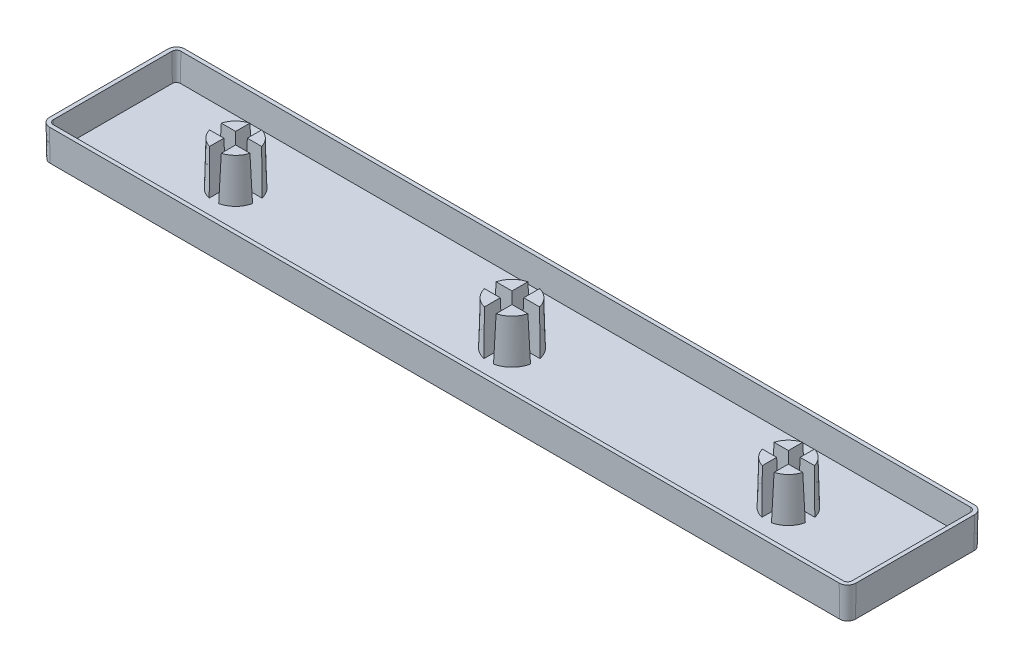
from build123d import *

# Parameters (mm, degrees)
BOSS_EXTRUDE1_DEPTH            = 4
BOSS_EXTRUDE1_DRAFT            = -1
SHELL1_T                       = -0.5
BOSS_EXTRUDE2_DEPTH            = 5.5
BOSS_EXTRUDE2_DRAFT            = 1.5
BOSS_EXTRUDE2_PROFILE_2_DEPTH  = 5.5
BOSS_EXTRUDE2_PROFILE_2_DRAFT  = 1.5
BOSS_EXTRUDE2_PROFILE_3_DEPTH  = 5.5
BOSS_EXTRUDE2_PROFILE_3_DRAFT  = 1.5
BOSS_EXTRUDE2_PROFILE_4_DEPTH  = 5.5
BOSS_EXTRUDE2_PROFILE_4_DRAFT  = 1.5
BOSS_EXTRUDE2_PROFILE_5_DEPTH  = 5.5
BOSS_EXTRUDE2_PROFILE_5_DRAFT  = 1.5
BOSS_EXTRUDE2_PROFILE_6_DEPTH  = 5.5
BOSS_EXTRUDE2_PROFILE_6_DRAFT  = 1.5
BOSS_EXTRUDE2_PROFILE_7_DEPTH  = 5.5
BOSS_EXTRUDE2_PROFILE_7_DRAFT  = 1.5
BOSS_EXTRUDE2_PROFILE_8_DEPTH  = 5.5
BOSS_EXTRUDE2_PROFILE_8_DRAFT  = 1.5
BOSS_EXTRUDE2_PROFILE_9_DEPTH  = 5.5
BOSS_EXTRUDE2_PROFILE_9_DRAFT  = 1.5
BOSS_EXTRUDE2_PROFILE_10_DEPTH = 5.5
BOSS_EXTRUDE2_PROFILE_10_DRAFT = 1.5
BOSS_EXTRUDE2_PROFILE_11_DEPTH = 5.5
BOSS_EXTRUDE2_PROFILE_11_DRAFT = 1.5
BOSS_EXTRUDE2_PROFILE_12_DEPTH = 5.5
BOSS_EXTRUDE2_PROFILE_12_DRAFT = 1.5


with BuildPart() as part:
    # Sketch1 → Boss-Extrude1 (with draft: the straight prism first)
    with BuildSketch(Plane(origin=(0, 0, 0), x_dir=(1, 0, 0), z_dir=(0, 1, 0))):
        with BuildLine():
            Line((-50, -8.5), (50, -8.5))
            ThreePointArc((50, -8.5), (50.707106781, -8.207106781), (51, -7.5))
            Line((51, -7.5), (51, 7.5))
            ThreePointArc((51, 7.5), (50.707106781, 8.207106781), (50, 8.5))
            Line((50, 8.5), (-50, 8.5))
            ThreePointArc((-50, 8.5), (-50.707106781, 8.207106781), (-51, 7.5))
            Line((-51, 7.5), (-51, -7.5))
            ThreePointArc((-51, -7.5), (-50.707106781, -8.207106781), (-50, -8.5))
        make_face()
    extrude(amount=BOSS_EXTRUDE1_DEPTH)
    # Boss-Extrude1: the draft: its side faces are tilted about the plane it starts from
    boss_extrude1_sides = [part.faces().sort_by_distance(p)[0] for p in [
        (0, 2, 8.5),
        (50.707106781, 2, 8.207106781),
        (51, 2, 0),
        (50.707106781, 2, -8.207106781),
        (0, 2, -8.5),
        (-50.707106781, 2, -8.207106781),
        (-51, 2, 0),
        (-50.707106781, 2, 8.207106781),
    ]]
    draft(boss_extrude1_sides, Plane(origin=(0, 0, 0), x_dir=(1, 0, 0), z_dir=(0, 1, 0)), BOSS_EXTRUDE1_DRAFT)

    # Shell1
    shell1_openings = [part.faces().sort_by_distance(p)[0] for p in [
        (0, 4, 0),
    ]]
    offset(amount=SHELL1_T, openings=shell1_openings, kind=Kind.INTERSECTION)


with BuildPart() as boss_extrude2_tool:
    # Sketch2 → Boss-Extrude2 (with draft: the straight prism first)
    with BuildSketch(Plane(origin=(0, 0.5, 0), x_dir=(1, 0, 0), z_dir=(0, 1, 0))):
        with BuildLine():
            ThreePointArc((-0.6, 2.939387691), (-2.121320344, 2.121320344), (-2.939387691, 0.6))
            Line((-2.939387691, 0.6), (-0.6, 0.6))
            Line((-0.6, 0.6), (-0.6, 2.939387691))
        make_face()
    extrude(amount=BOSS_EXTRUDE2_DEPTH)
    # Boss-Extrude2: the draft: its side faces are tilted about the plane it starts from
    boss_extrude2_sides = [boss_extrude2_tool.faces().sort_by_distance(p)[0] for p in [
        (-2.121320344, 3.25, -2.121320344),
        (-1.769693846, 3.25, -0.6),
        (-0.6, 3.25, -1.769693846),
    ]]
    draft(boss_extrude2_sides, Plane(origin=(0, 0.5, 0), x_dir=(1, 0, 0), z_dir=(0, 1, 0)), BOSS_EXTRUDE2_DRAFT)


with BuildPart() as part_1:
    add(part.part)

    # Boss-Extrude2: add boss_extrude2_tool
    add(boss_extrude2_tool.part)


with BuildPart() as boss_extrude2_profile_2_tool:
    # Sketch2 → Boss-Extrude2 profile 2 (with draft: the straight prism first)
    with BuildSketch(Plane(origin=(0, 0.5, 0), x_dir=(1, 0, 0), z_dir=(0, 1, 0))):
        with BuildLine():
            ThreePointArc((-2.939387691, -0.6), (-2.121320344, -2.121320344), (-0.6, -2.939387691))
            Line((-0.6, -2.939387691), (-0.6, -0.6))
            Line((-0.6, -0.6), (-2.939387691, -0.6))
        make_face()
    extrude(amount=BOSS_EXTRUDE2_PROFILE_2_DEPTH)
    # Boss-Extrude2 profile 2: the draft: its side faces are tilted about the plane it starts from
    boss_extrude2_profile_2_sides = [boss_extrude2_profile_2_tool.faces().sort_by_distance(p)[0] for p in [
        (-2.121320344, 3.25, 2.121320344),
        (-0.6, 3.25, 1.769693846),
        (-1.769693846, 3.25, 0.6),
    ]]
    draft(boss_extrude2_profile_2_sides, Plane(origin=(0, 0.5, 0), x_dir=(1, 0, 0), z_dir=(0, 1, 0)), BOSS_EXTRUDE2_PROFILE_2_DRAFT)


with BuildPart() as part_2:
    add(part_1.part)

    # Boss-Extrude2 profile 2: add boss_extrude2_profile_2_tool
    add(boss_extrude2_profile_2_tool.part)


with BuildPart() as boss_extrude2_profile_3_tool:
    # Sketch2 → Boss-Extrude2 profile 3 (with draft: the straight prism first)
    with BuildSketch(Plane(origin=(0, 0.5, 0), x_dir=(1, 0, 0), z_dir=(0, 1, 0))):
        with BuildLine():
            Line((0.6, 2.939387691), (0.6, 0.6))
            Line((0.6, 0.6), (2.939387691, 0.6))
            ThreePointArc((2.939387691, 0.6), (2.121320344, 2.121320344), (0.6, 2.939387691))
        make_face()
    extrude(amount=BOSS_EXTRUDE2_PROFILE_3_DEPTH)
    # Boss-Extrude2 profile 3: the draft: its side faces are tilted about the plane it starts from
    boss_extrude2_profile_3_sides = [boss_extrude2_profile_3_tool.faces().sort_by_distance(p)[0] for p in [
        (0.6, 3.25, -1.769693846),
        (1.769693846, 3.25, -0.6),
        (2.121320344, 3.25, -2.121320344),
    ]]
    draft(boss_extrude2_profile_3_sides, Plane(origin=(0, 0.5, 0), x_dir=(1, 0, 0), z_dir=(0, 1, 0)), BOSS_EXTRUDE2_PROFILE_3_DRAFT)


with BuildPart() as part_3:
    add(part_2.part)

    # Boss-Extrude2 profile 3: add boss_extrude2_profile_3_tool
    add(boss_extrude2_profile_3_tool.part)


with BuildPart() as boss_extrude2_profile_4_tool:
    # Sketch2 → Boss-Extrude2 profile 4 (with draft: the straight prism first)
    with BuildSketch(Plane(origin=(0, 0.5, 0), x_dir=(1, 0, 0), z_dir=(0, 1, 0))):
        with BuildLine():
            ThreePointArc((-35.6, 2.742896105), (-36.985381455, 1.985381455), (-37.742896105, 0.6))
            Line((-37.742896105, 0.6), (-35.6, 0.6))
            Line((-35.6, 0.6), (-35.6, 2.742896105))
        make_face()
    extrude(amount=BOSS_EXTRUDE2_PROFILE_4_DEPTH)
    # Boss-Extrude2 profile 4: the draft: its side faces are tilted about the plane it starts from
    boss_extrude2_profile_4_sides = [boss_extrude2_profile_4_tool.faces().sort_by_distance(p)[0] for p in [
        (-36.985381455, 3.25, -1.985381455),
        (-36.671448053, 3.25, -0.6),
        (-35.6, 3.25, -1.671448053),
    ]]
    draft(boss_extrude2_profile_4_sides, Plane(origin=(0, 0.5, 0), x_dir=(1, 0, 0), z_dir=(0, 1, 0)), BOSS_EXTRUDE2_PROFILE_4_DRAFT)


with BuildPart() as part_4:
    add(part_3.part)

    # Boss-Extrude2 profile 4: add boss_extrude2_profile_4_tool
    add(boss_extrude2_profile_4_tool.part)


with BuildPart() as boss_extrude2_profile_5_tool:
    # Sketch2 → Boss-Extrude2 profile 5 (with draft: the straight prism first)
    with BuildSketch(Plane(origin=(0, 0.5, 0), x_dir=(1, 0, 0), z_dir=(0, 1, 0))):
        with BuildLine():
            Line((-34.4, 2.742896105), (-34.4, 0.6))
            Line((-34.4, 0.6), (-32.257103895, 0.6))
            ThreePointArc((-32.257103895, 0.6), (-33.014618545, 1.985381455), (-34.4, 2.742896105))
        make_face()
    extrude(amount=BOSS_EXTRUDE2_PROFILE_5_DEPTH)
    # Boss-Extrude2 profile 5: the draft: its side faces are tilted about the plane it starts from
    boss_extrude2_profile_5_sides = [boss_extrude2_profile_5_tool.faces().sort_by_distance(p)[0] for p in [
        (-34.4, 3.25, -1.671448053),
        (-33.328551947, 3.25, -0.6),
        (-33.014618545, 3.25, -1.985381455),
    ]]
    draft(boss_extrude2_profile_5_sides, Plane(origin=(0, 0.5, 0), x_dir=(1, 0, 0), z_dir=(0, 1, 0)), BOSS_EXTRUDE2_PROFILE_5_DRAFT)


with BuildPart() as part_5:
    add(part_4.part)

    # Boss-Extrude2 profile 5: add boss_extrude2_profile_5_tool
    add(boss_extrude2_profile_5_tool.part)


with BuildPart() as boss_extrude2_profile_6_tool:
    # Sketch2 → Boss-Extrude2 profile 6 (with draft: the straight prism first)
    with BuildSketch(Plane(origin=(0, 0.5, 0), x_dir=(1, 0, 0), z_dir=(0, 1, 0))):
        with BuildLine():
            ThreePointArc((-37.742896105, -0.6), (-36.985381455, -1.985381455), (-35.6, -2.742896105))
            Line((-35.6, -2.742896105), (-35.6, -0.6))
            Line((-35.6, -0.6), (-37.742896105, -0.6))
        make_face()
    extrude(amount=BOSS_EXTRUDE2_PROFILE_6_DEPTH)
    # Boss-Extrude2 profile 6: the draft: its side faces are tilted about the plane it starts from
    boss_extrude2_profile_6_sides = [boss_extrude2_profile_6_tool.faces().sort_by_distance(p)[0] for p in [
        (-36.985381455, 3.25, 1.985381455),
        (-35.6, 3.25, 1.671448053),
        (-36.671448053, 3.25, 0.6),
    ]]
    draft(boss_extrude2_profile_6_sides, Plane(origin=(0, 0.5, 0), x_dir=(1, 0, 0), z_dir=(0, 1, 0)), BOSS_EXTRUDE2_PROFILE_6_DRAFT)


with BuildPart() as part_6:
    add(part_5.part)

    # Boss-Extrude2 profile 6: add boss_extrude2_profile_6_tool
    add(boss_extrude2_profile_6_tool.part)


with BuildPart() as boss_extrude2_profile_7_tool:
    # Sketch2 → Boss-Extrude2 profile 7 (with draft: the straight prism first)
    with BuildSketch(Plane(origin=(0, 0.5, 0), x_dir=(1, 0, 0), z_dir=(0, 1, 0))):
        with BuildLine():
            ThreePointArc((34.4, 2.742896105), (33.014618545, 1.985381455), (32.257103895, 0.6))
            Line((32.257103895, 0.6), (34.4, 0.6))
            Line((34.4, 0.6), (34.4, 2.742896105))
        make_face()
    extrude(amount=BOSS_EXTRUDE2_PROFILE_7_DEPTH)
    # Boss-Extrude2 profile 7: the draft: its side faces are tilted about the plane it starts from
    boss_extrude2_profile_7_sides = [boss_extrude2_profile_7_tool.faces().sort_by_distance(p)[0] for p in [
        (33.014618545, 3.25, -1.985381455),
        (33.328551947, 3.25, -0.6),
        (34.4, 3.25, -1.671448053),
    ]]
    draft(boss_extrude2_profile_7_sides, Plane(origin=(0, 0.5, 0), x_dir=(1, 0, 0), z_dir=(0, 1, 0)), BOSS_EXTRUDE2_PROFILE_7_DRAFT)


with BuildPart() as part_7:
    add(part_6.part)

    # Boss-Extrude2 profile 7: add boss_extrude2_profile_7_tool
    add(boss_extrude2_profile_7_tool.part)


with BuildPart() as boss_extrude2_profile_8_tool:
    # Sketch2 → Boss-Extrude2 profile 8 (with draft: the straight prism first)
    with BuildSketch(Plane(origin=(0, 0.5, 0), x_dir=(1, 0, 0), z_dir=(0, 1, 0))):
        with BuildLine():
            ThreePointArc((32.257103895, -0.6), (33.014618545, -1.985381455), (34.4, -2.742896105))
            Line((34.4, -2.742896105), (34.4, -0.6))
            Line((34.4, -0.6), (32.257103895, -0.6))
        make_face()
    extrude(amount=BOSS_EXTRUDE2_PROFILE_8_DEPTH)
    # Boss-Extrude2 profile 8: the draft: its side faces are tilted about the plane it starts from
    boss_extrude2_profile_8_sides = [boss_extrude2_profile_8_tool.faces().sort_by_distance(p)[0] for p in [
        (33.014618545, 3.25, 1.985381455),
        (34.4, 3.25, 1.671448053),
        (33.328551947, 3.25, 0.6),
    ]]
    draft(boss_extrude2_profile_8_sides, Plane(origin=(0, 0.5, 0), x_dir=(1, 0, 0), z_dir=(0, 1, 0)), BOSS_EXTRUDE2_PROFILE_8_DRAFT)


with BuildPart() as part_8:
    add(part_7.part)

    # Boss-Extrude2 profile 8: add boss_extrude2_profile_8_tool
    add(boss_extrude2_profile_8_tool.part)


with BuildPart() as boss_extrude2_profile_9_tool:
    # Sketch2 → Boss-Extrude2 profile 9 (with draft: the straight prism first)
    with BuildSketch(Plane(origin=(0, 0.5, 0), x_dir=(1, 0, 0), z_dir=(0, 1, 0))):
        with BuildLine():
            Line((35.6, 2.742896105), (35.6, 0.6))
            Line((35.6, 0.6), (37.742896105, 0.6))
            ThreePointArc((37.742896105, 0.6), (36.985381455, 1.985381455), (35.6, 2.742896105))
        make_face()
    extrude(amount=BOSS_EXTRUDE2_PROFILE_9_DEPTH)
    # Boss-Extrude2 profile 9: the draft: its side faces are tilted about the plane it starts from
    boss_extrude2_profile_9_sides = [boss_extrude2_profile_9_tool.faces().sort_by_distance(p)[0] for p in [
        (35.6, 3.25, -1.671448053),
        (36.671448053, 3.25, -0.6),
        (36.985381455, 3.25, -1.985381455),
    ]]
    draft(boss_extrude2_profile_9_sides, Plane(origin=(0, 0.5, 0), x_dir=(1, 0, 0), z_dir=(0, 1, 0)), BOSS_EXTRUDE2_PROFILE_9_DRAFT)


with BuildPart() as part_9:
    add(part_8.part)

    # Boss-Extrude2 profile 9: add boss_extrude2_profile_9_tool
    add(boss_extrude2_profile_9_tool.part)


with BuildPart() as boss_extrude2_profile_10_tool:
    # Sketch2 → Boss-Extrude2 profile 10 (with draft: the straight prism first)
    with BuildSketch(Plane(origin=(0, 0.5, 0), x_dir=(1, 0, 0), z_dir=(0, 1, 0))):
        with BuildLine():
            Line((35.6, -0.6), (35.6, -2.742896105))
            ThreePointArc((35.6, -2.742896105), (36.985381455, -1.985381455), (37.742896105, -0.6))
            Line((37.742896105, -0.6), (35.6, -0.6))
        make_face()
    extrude(amount=BOSS_EXTRUDE2_PROFILE_10_DEPTH)
    # Boss-Extrude2 profile 10: the draft: its side faces are tilted about the plane it starts from
    boss_extrude2_profile_10_sides = [boss_extrude2_profile_10_tool.faces().sort_by_distance(p)[0] for p in [
        (36.671448053, 3.25, 0.6),
        (35.6, 3.25, 1.671448053),
        (36.985381455, 3.25, 1.985381455),
    ]]
    draft(boss_extrude2_profile_10_sides, Plane(origin=(0, 0.5, 0), x_dir=(1, 0, 0), z_dir=(0, 1, 0)), BOSS_EXTRUDE2_PROFILE_10_DRAFT)


with BuildPart() as part_10:
    add(part_9.part)

    # Boss-Extrude2 profile 10: add boss_extrude2_profile_10_tool
    add(boss_extrude2_profile_10_tool.part)


with BuildPart() as boss_extrude2_profile_11_tool:
    # Sketch2 → Boss-Extrude2 profile 11 (with draft: the straight prism first)
    with BuildSketch(Plane(origin=(0, 0.5, 0), x_dir=(1, 0, 0), z_dir=(0, 1, 0))):
        with BuildLine():
            Line((0.6, -0.6), (0.6, -2.939387691))
            ThreePointArc((0.6, -2.939387691), (2.121320344, -2.121320344), (2.939387691, -0.6))
            Line((2.939387691, -0.6), (0.6, -0.6))
        make_face()
    extrude(amount=BOSS_EXTRUDE2_PROFILE_11_DEPTH)
    # Boss-Extrude2 profile 11: the draft: its side faces are tilted about the plane it starts from
    boss_extrude2_profile_11_sides = [boss_extrude2_profile_11_tool.faces().sort_by_distance(p)[0] for p in [
        (1.769693846, 3.25, 0.6),
        (0.6, 3.25, 1.769693846),
        (2.121320344, 3.25, 2.121320344),
    ]]
    draft(boss_extrude2_profile_11_sides, Plane(origin=(0, 0.5, 0), x_dir=(1, 0, 0), z_dir=(0, 1, 0)), BOSS_EXTRUDE2_PROFILE_11_DRAFT)


with BuildPart() as part_11:
    add(part_10.part)

    # Boss-Extrude2 profile 11: add boss_extrude2_profile_11_tool
    add(boss_extrude2_profile_11_tool.part)


with BuildPart() as boss_extrude2_profile_12_tool:
    # Sketch2 → Boss-Extrude2 profile 12 (with draft: the straight prism first)
    with BuildSketch(Plane(origin=(0, 0.5, 0), x_dir=(1, 0, 0), z_dir=(0, 1, 0))):
        with BuildLine():
            Line((-34.4, -0.6), (-34.4, -2.742896105))
            ThreePointArc((-34.4, -2.742896105), (-33.014618545, -1.985381455), (-32.257103895, -0.6))
            Line((-32.257103895, -0.6), (-34.4, -0.6))
        make_face()
    extrude(amount=BOSS_EXTRUDE2_PROFILE_12_DEPTH)
    # Boss-Extrude2 profile 12: the draft: its side faces are tilted about the plane it starts from
    boss_extrude2_profile_12_sides = [boss_extrude2_profile_12_tool.faces().sort_by_distance(p)[0] for p in [
        (-33.328551947, 3.25, 0.6),
        (-34.4, 3.25, 1.671448053),
        (-33.014618545, 3.25, 1.985381455),
    ]]
    draft(boss_extrude2_profile_12_sides, Plane(origin=(0, 0.5, 0), x_dir=(1, 0, 0), z_dir=(0, 1, 0)), BOSS_EXTRUDE2_PROFILE_12_DRAFT)


with BuildPart() as part_12:
    add(part_11.part)

    # Boss-Extrude2 profile 12: add boss_extrude2_profile_12_tool
    add(boss_extrude2_profile_12_tool.part)


solid = part_12.part
